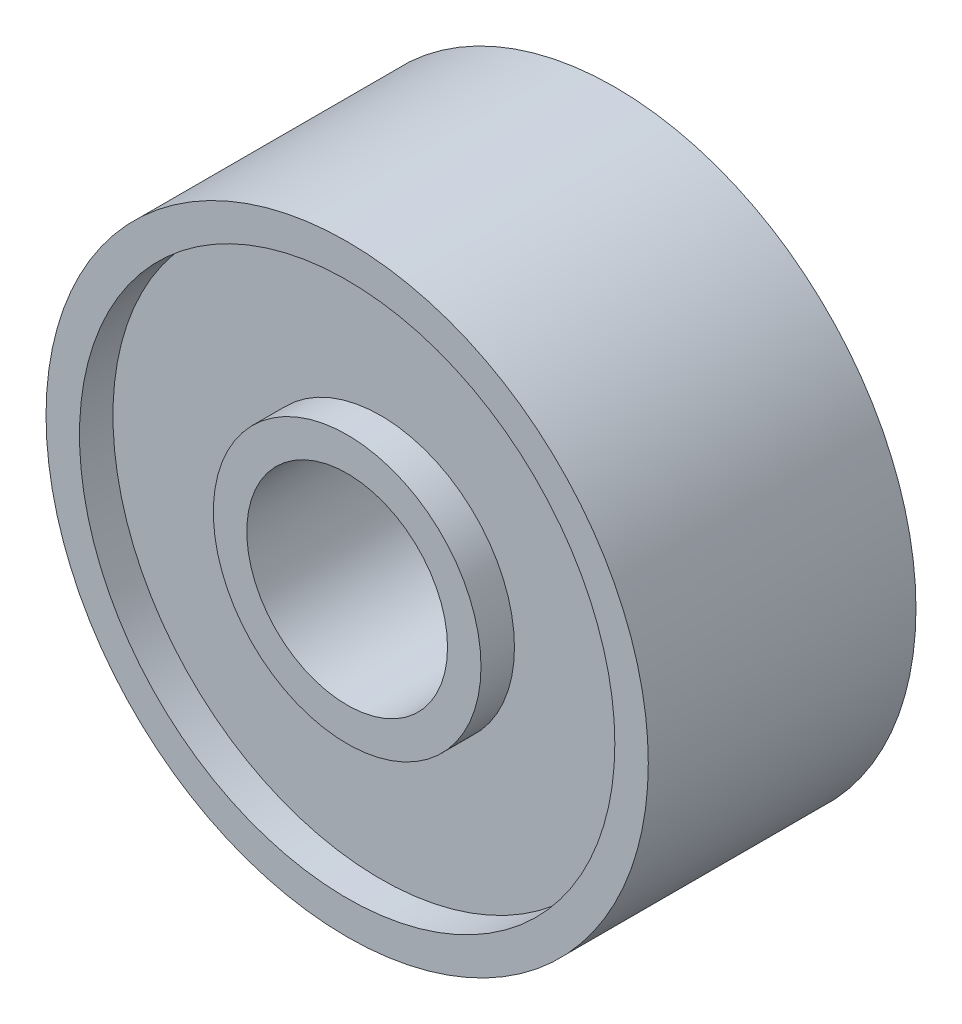
from build123d import *

# Parameters (mm, degrees)
SKETCH_1_R          = 4.5
EXTRUDE_1_DEPTH     = 2
SKETCH_2_R          = 1.5
CUT_EXTRUDE_1_DEPTH = 8.516648189
SKETCH_3_R          = 4
SKETCH_3_R_2        = 2
CUT_EXTRUDE_2_DEPTH = 0.5


with BuildPart() as part:
    # 草圖1 → 填料-伸長1 (new, symmetric)
    with BuildSketch(Plane.XY):
        Circle(SKETCH_1_R)
    extrude(amount=EXTRUDE_1_DEPTH, both=True)

    # 草圖2 → 除料-伸長1 (cut, through all)
    with BuildSketch(Plane.XY.offset(2)):
        Circle(SKETCH_2_R)
    extrude(amount=-CUT_EXTRUDE_1_DEPTH, mode=Mode.SUBTRACT)

    # 草圖3 → 除料-伸長2 (cut)
    with BuildSketch(Plane.XY.offset(2)):
        Circle(SKETCH_3_R)
        Circle(SKETCH_3_R_2, mode=Mode.SUBTRACT)
    cut_extrude_2 = extrude(amount=-CUT_EXTRUDE_2_DEPTH, mode=Mode.SUBTRACT)

    # 鏡射1: 除料-伸長2 across plane
    add(cut_extrude_2.mirror(Plane.XY), mode=Mode.SUBTRACT)


solid = part.part
